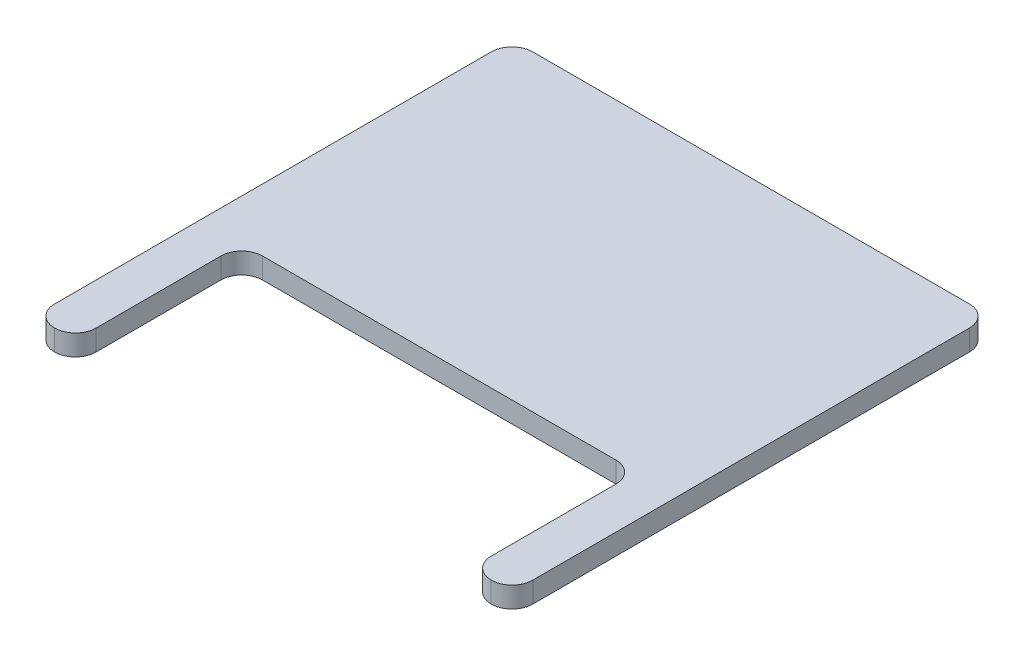
from build123d import *

# Parameters (mm, degrees)
BOSS_EXTRUDE1_DEPTH = 6.35
FILLET1_R           = 6.35


with BuildPart() as part:
    # Sketch1 → Boss-Extrude1 (new body)
    with BuildSketch(Plane(origin=(0, 0, 0), x_dir=(1, 0, 0), z_dir=(0, 1, 0))):
        Polygon((-133.35, -146.05), (-146.05, -146.05), (-146.05, 0), (0, 0), (0, -146.05), (-12.7, -146.05), (-12.7, -95.25), (-133.35, -95.25), align=None)
    extrude(amount=BOSS_EXTRUDE1_DEPTH)

    # Fillet1
    fillet1_edges = [part.edges().sort_by_distance(p)[0] for p in [
        (-12.7, 3.175, 95.25),
        (-133.35, 3.175, 95.25),
        (0, 3.175, 146.05),
        (-146.05, 3.175, 0),
        (0, 3.175, 0),
        (-12.7, 3.175, 146.05),
        (-146.05, 3.175, 146.05),
        (-133.35, 3.175, 146.05),
    ]]
    fillet(fillet1_edges, radius=FILLET1_R - 0.0001)  # a hair under: the kernel refuses the full size


solid = part.part
